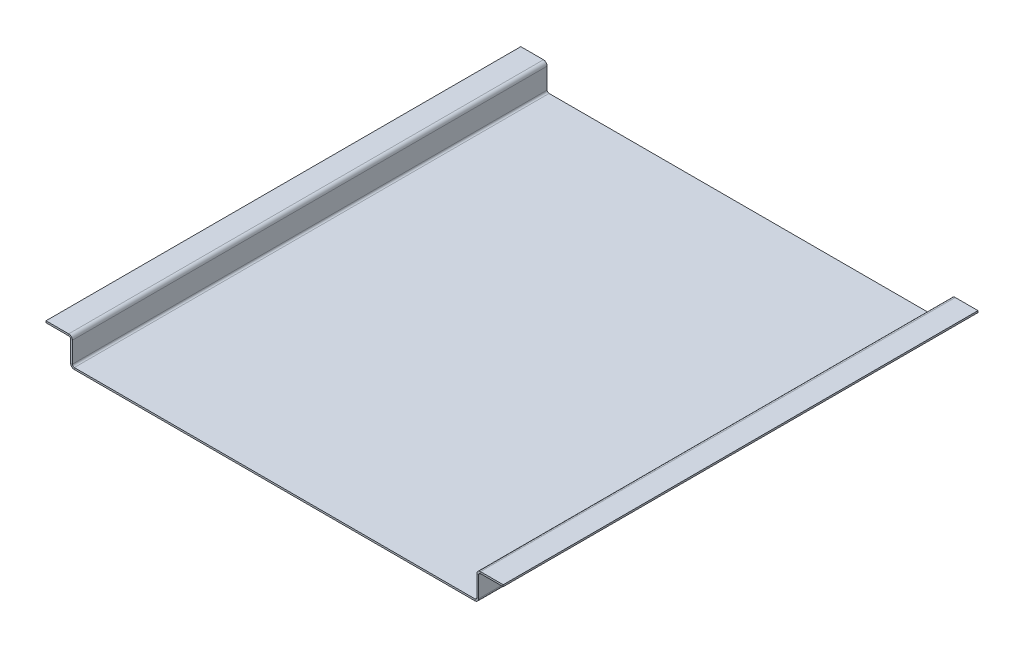
from build123d import *

# Parameters (mm, degrees)
SM_BASE_FLANGE_1_DEPTH = 270


# Sheet-metal steps are written as plain solids
with BuildPart() as part:
    # Sketch 1 → Базовая кромка1 (new body)
    with BuildSketch(Plane.XY):
        with BuildLine():
            Line((-72.699950579, -46.113225058), (-59.799950579, -46.113225058))
            ThreePointArc((-59.799950579, -46.113225058), (-58.315026339, -46.728300818), (-57.699950579, -48.213225058))
            Line((-57.699950579, -48.213225058), (-57.699950579, -60.013225058))
            ThreePointArc((-57.699950579, -60.013225058), (-57.377768038, -60.791042517), (-56.599950579, -61.113225058))
            Line((-56.599950579, -61.113225058), (171.200049421, -61.113225058))
            ThreePointArc((171.200049421, -61.113225058), (171.97786688, -60.791042517), (172.300049421, -60.013225058))
            Line((172.300049421, -60.013225058), (172.300049421, -48.213225058))
            ThreePointArc((172.300049421, -48.213225058), (172.915125181, -46.728300818), (174.400049421, -46.113225058))
            Line((174.400049421, -46.113225058), (187.300049421, -46.113225058))
            Line((187.300049421, -46.113225058), (187.300049421, -47.113225058))
            Line((187.300049421, -47.113225058), (174.400049421, -47.113225058))
            ThreePointArc((174.400049421, -47.113225058), (173.622231962, -47.435407599), (173.300049421, -48.213225058))
            Line((173.300049421, -48.213225058), (173.300049421, -60.013225058))
            ThreePointArc((173.300049421, -60.013225058), (172.684973661, -61.498149299), (171.200049421, -62.113225058))
            Line((171.200049421, -62.113225058), (-56.599950579, -62.113225058))
            ThreePointArc((-56.599950579, -62.113225058), (-58.084874819, -61.498149298), (-58.699950579, -60.013225058))
            Line((-58.699950579, -60.013225058), (-58.699950579, -48.213225058))
            ThreePointArc((-58.699950579, -48.213225058), (-59.02213312, -47.435407599), (-59.799950579, -47.113225058))
            Line((-59.799950579, -47.113225058), (-72.699950579, -47.113225058))
            Line((-72.699950579, -47.113225058), (-72.699950579, -46.113225058))
        make_face()
    extrude(amount=SM_BASE_FLANGE_1_DEPTH)


solid = part.part
